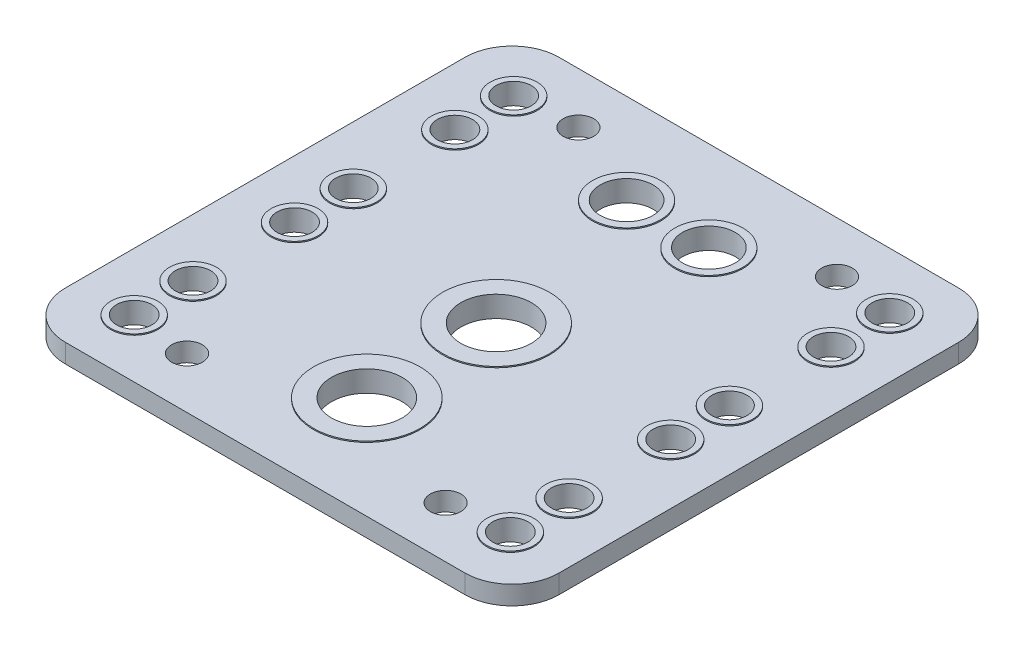
from build123d import *

# Parameters (mm, degrees)
SALIENTE_EXTRUIR1_DEPTH    = 0.8
CORTAR_EXTRUIR1_DEPTH      = 30.741553423
CORTAR_EXTRUIR1_DEPTH_BACK = 30.741553423
CROQUIS2_R                 = 1.3
CROQUIS3_R                 = 3
CORTAR_EXTRUIR2_DEPTH      = 30.741553423
CROQUIS5_R                 = 4.533685243
CROQUIS5_R_2               = 3
SALIENTE_EXTRUIR2_DEPTH    = 0.9
CROQUIS6_R                 = 2.25
CROQUIS6_R_2               = 1.5
CORTAR_EXTRUIR3_DEPTH      = 30.747100699
CROQUIS7_R                 = 2
CROQUIS7_R_2               = 1.5
CROQUIS7_R_3               = 2.894896359
CROQUIS7_R_4               = 2.25
SALIENTE_EXTRUIR3_DEPTH    = 0.9


with BuildPart() as part:
    # Croquis1 → Saliente-Extruir1 (new, symmetric)
    with BuildSketch(Plane(origin=(0, 0, 0), x_dir=(1, 0, 0), z_dir=(0, 1, 0))):
        with BuildLine():
            Line((-17, 21), (17, 21))
            ThreePointArc((17, 21), (19.828427125, 19.828427125), (21, 17))
            Line((21, 17), (21, -17))
            ThreePointArc((21, -17), (19.828427125, -19.828427125), (17, -21))
            Line((17, -21), (-17, -21))
            ThreePointArc((-17, -21), (-19.828427125, -19.828427125), (-21, -17))
            Line((-21, -17), (-21, 17))
            ThreePointArc((-21, 17), (-19.828427125, 19.828427125), (-17, 21))
        make_face()
    extrude(amount=SALIENTE_EXTRUIR1_DEPTH, both=True)

    # Croquis2 → Cortar-Extruir1 (cut, two sides: drawn at the far end of the back side and taken through both)
    with BuildSketch(Plane(origin=(0, 0.8, 0), x_dir=(1, 0, 0), z_dir=(0, 1, 0)).offset(-CORTAR_EXTRUIR1_DEPTH_BACK)):
        with Locations((-11, 16.65)):
            Circle(CROQUIS2_R)
        with Locations((11, 16.65)):
            Circle(CROQUIS2_R)
        with Locations((11, -16.65)):
            Circle(CROQUIS2_R)
        with Locations((-11, -16.65)):
            Circle(CROQUIS2_R)
    extrude(amount=CORTAR_EXTRUIR1_DEPTH + CORTAR_EXTRUIR1_DEPTH_BACK, mode=Mode.SUBTRACT)

    # Croquis3 → Cortar-Extruir2 (cut, through all)
    with BuildSketch(Plane(origin=(0, 0.8, 0), x_dir=(1, 0, 0), z_dir=(0, 1, 0))):
        with Locations((0, -12.352134629)):
            Circle(CROQUIS3_R)
        with Locations((0, -1.352134629)):
            Circle(CROQUIS3_R)
    extrude(amount=-CORTAR_EXTRUIR2_DEPTH, mode=Mode.SUBTRACT)

    # Croquis5 → Saliente-Extruir2 (add, symmetric)
    # profile 1 of 2: a face of its own
    with BuildSketch(Plane(origin=(0, 0, 0), x_dir=(1, 0, 0), z_dir=(0, 1, 0))):
        with Locations((0, -12.352134629)):
            Circle(CROQUIS5_R)
        with Locations((0, -12.352134629)):
            Circle(CROQUIS5_R_2, mode=Mode.SUBTRACT)
    # profile 2 of 2: a face of its own
    with BuildSketch(Plane(origin=(0, 0, 0), x_dir=(1, 0, 0), z_dir=(0, 1, 0))):
        with Locations((0, -1.352134629)):
            Circle(CROQUIS5_R)
        with Locations((0, -1.352134629)):
            Circle(CROQUIS5_R_2, mode=Mode.SUBTRACT)
    extrude(amount=SALIENTE_EXTRUIR2_DEPTH, both=True)

    # Croquis6 → Cortar-Extruir3 (cut, through all)
    with BuildSketch(Plane(origin=(0, 0.8, 0), x_dir=(1, 0, 0), z_dir=(0, 1, 0))):
        with Locations((-3.5, 13.25)):
            Circle(CROQUIS6_R)
        with Locations((3.5, 13.25)):
            Circle(CROQUIS6_R)
        with Locations((-16, 2.5)):
            Circle(CROQUIS6_R_2)
        with Locations((-16, -2.5)):
            Circle(CROQUIS6_R_2)
        with Locations((-16, 11.14)):
            Circle(CROQUIS6_R_2)
        with Locations((-16, 16.14)):
            Circle(CROQUIS6_R_2)
        with Locations((-16, -11.14)):
            Circle(CROQUIS6_R_2)
        with Locations((-16, -16.14)):
            Circle(CROQUIS6_R_2)
        with Locations((16, -16.14)):
            Circle(CROQUIS6_R_2)
        with Locations((16, -11.14)):
            Circle(CROQUIS6_R_2)
        with Locations((16, 16.14)):
            Circle(CROQUIS6_R_2)
        with Locations((16, 11.14)):
            Circle(CROQUIS6_R_2)
        with Locations((16, -2.5)):
            Circle(CROQUIS6_R_2)
        with Locations((16, 2.5)):
            Circle(CROQUIS6_R_2)
    extrude(amount=-CORTAR_EXTRUIR3_DEPTH, mode=Mode.SUBTRACT)

    # Croquis7 → Saliente-Extruir3 (add, symmetric)
    # profile 1 of 14: a face of its own
    with BuildSketch(Plane(origin=(0, 0, 0), x_dir=(1, 0, 0), z_dir=(0, 1, 0))):
        with Locations((-16, 16.14)):
            Circle(CROQUIS7_R)
        with Locations((-16, 16.14)):
            Circle(CROQUIS7_R_2, mode=Mode.SUBTRACT)
    # profile 2 of 14: a face of its own
    with BuildSketch(Plane(origin=(0, 0, 0), x_dir=(1, 0, 0), z_dir=(0, 1, 0))):
        with Locations((-16, 11.14)):
            Circle(CROQUIS7_R)
        with Locations((-16, 11.14)):
            Circle(CROQUIS7_R_2, mode=Mode.SUBTRACT)
    # profile 3 of 14: a face of its own
    with BuildSketch(Plane(origin=(0, 0, 0), x_dir=(1, 0, 0), z_dir=(0, 1, 0))):
        with Locations((-16, 2.5)):
            Circle(CROQUIS7_R)
        with Locations((-16, 2.5)):
            Circle(CROQUIS7_R_2, mode=Mode.SUBTRACT)
    # profile 4 of 14: a face of its own
    with BuildSketch(Plane(origin=(0, 0, 0), x_dir=(1, 0, 0), z_dir=(0, 1, 0))):
        with Locations((-16, -2.5)):
            Circle(CROQUIS7_R)
        with Locations((-16, -2.5)):
            Circle(CROQUIS7_R_2, mode=Mode.SUBTRACT)
    # profile 5 of 14: a face of its own
    with BuildSketch(Plane(origin=(0, 0, 0), x_dir=(1, 0, 0), z_dir=(0, 1, 0))):
        with Locations((-16, -16.14)):
            Circle(CROQUIS7_R)
        with Locations((-16, -16.14)):
            Circle(CROQUIS7_R_2, mode=Mode.SUBTRACT)
    # profile 6 of 14: a face of its own
    with BuildSketch(Plane(origin=(0, 0, 0), x_dir=(1, 0, 0), z_dir=(0, 1, 0))):
        with Locations((-16, -11.14)):
            Circle(CROQUIS7_R)
        with Locations((-16, -11.14)):
            Circle(CROQUIS7_R_2, mode=Mode.SUBTRACT)
    # profile 7 of 14: a face of its own
    with BuildSketch(Plane(origin=(0, 0, 0), x_dir=(1, 0, 0), z_dir=(0, 1, 0))):
        with Locations((-3.5, 13.25)):
            Circle(CROQUIS7_R_3)
        with Locations((-3.5, 13.25)):
            Circle(CROQUIS7_R_4, mode=Mode.SUBTRACT)
    # profile 8 of 14: a face of its own
    with BuildSketch(Plane(origin=(0, 0, 0), x_dir=(1, 0, 0), z_dir=(0, 1, 0))):
        with Locations((3.5, 13.25)):
            Circle(CROQUIS7_R_3)
        with Locations((3.5, 13.25)):
            Circle(CROQUIS7_R_4, mode=Mode.SUBTRACT)
    # profile 9 of 14: a face of its own
    with BuildSketch(Plane(origin=(0, 0, 0), x_dir=(1, 0, 0), z_dir=(0, 1, 0))):
        with Locations((16, -11.14)):
            Circle(CROQUIS7_R)
        with Locations((16, -11.14)):
            Circle(CROQUIS7_R_2, mode=Mode.SUBTRACT)
    # profile 10 of 14: a face of its own
    with BuildSketch(Plane(origin=(0, 0, 0), x_dir=(1, 0, 0), z_dir=(0, 1, 0))):
        with Locations((16, -16.14)):
            Circle(CROQUIS7_R)
        with Locations((16, -16.14)):
            Circle(CROQUIS7_R_2, mode=Mode.SUBTRACT)
    # profile 11 of 14: a face of its own
    with BuildSketch(Plane(origin=(0, 0, 0), x_dir=(1, 0, 0), z_dir=(0, 1, 0))):
        with Locations((16, -2.5)):
            Circle(CROQUIS7_R)
        with Locations((16, -2.5)):
            Circle(CROQUIS7_R_2, mode=Mode.SUBTRACT)
    # profile 12 of 14: a face of its own
    with BuildSketch(Plane(origin=(0, 0, 0), x_dir=(1, 0, 0), z_dir=(0, 1, 0))):
        with Locations((16, 2.5)):
            Circle(CROQUIS7_R)
        with Locations((16, 2.5)):
            Circle(CROQUIS7_R_2, mode=Mode.SUBTRACT)
    # profile 13 of 14: a face of its own
    with BuildSketch(Plane(origin=(0, 0, 0), x_dir=(1, 0, 0), z_dir=(0, 1, 0))):
        with Locations((16, 11.14)):
            Circle(CROQUIS7_R)
        with Locations((16, 11.14)):
            Circle(CROQUIS7_R_2, mode=Mode.SUBTRACT)
    # profile 14 of 14: a face of its own
    with BuildSketch(Plane(origin=(0, 0, 0), x_dir=(1, 0, 0), z_dir=(0, 1, 0))):
        with Locations((16, 16.14)):
            Circle(CROQUIS7_R)
        with Locations((16, 16.14)):
            Circle(CROQUIS7_R_2, mode=Mode.SUBTRACT)
    extrude(amount=SALIENTE_EXTRUIR3_DEPTH, both=True)


solid = part.part
